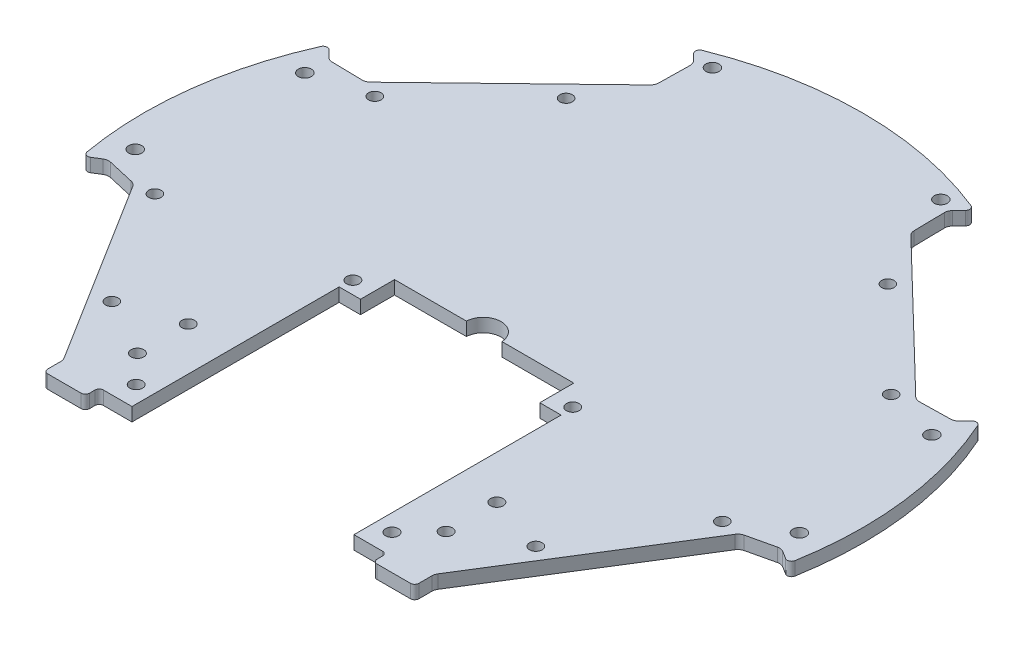
from build123d import *

# Parameters (mm, degrees)
BOSS_EXTRUDE4_DEPTH  = 1.5875
M3_CLEARANCE_HOLE3_D = 3
M3_CLEARANCE_HOLE1_D = 3.1
M3_CLEARANCE_HOLE4_D = 2.95
M3_CLEARANCE_HOLE2_D = 3.1
BOSS_EXTRUDE6_DEPTH  = 3.175
FILLET1_R            = 2
FILLET3_R            = 1
FILLET6_R            = 0.5
CUT_EXTRUDE4_DEPTH   = 10
SKETCH29_R           = 1.5
CUT_EXTRUDE5_DEPTH   = 10
SKETCH31_R           = 1.5
CUT_EXTRUDE7_DEPTH   = 10


with BuildPart() as part:
    # Sketch1 → Boss-Extrude4 (new, symmetric)
    with BuildSketch(Plane(origin=(0, 0, 0), x_dir=(1, 0, 0), z_dir=(0, 1, 0))):
        with BuildLine():
            Line((-62.799553621, 32.496136604), (-73.969425011, 32.691107434))
            Line((-73.969425011, 32.691107434), (-77.053684287, 35.88495141))
            ThreePointArc((-77.053684287, 35.88495141), (-84.36642289, 10.358894189), (-83.446216027, -16.178041625))
            Line((-83.446216027, -16.178041625), (-79.680911643, -13.825218315))
            Line((-79.680911643, -13.825218315), (-69.484649137, -16.179210996))
            Line((-69.484649137, -16.179210996), (-43.894490772, -57.132025032))
            Line((-43.894490772, -57.132025032), (-43.894490772, -64.826600275))
            Line((-43.894490772, -64.826600275), (-43.094490772, -64.826600275))
            Line((-43.094490772, -64.826600275), (-34, -64.826600275))
            Line((-34, -64.826600275), (-34, -62.55))
            Line((-34, -62.55), (-34, -61.55))
            Line((-34, -61.55), (-20, -61.55))
            Line((-20, -61.55), (-19.859459165, -62.55))
            Line((-19.859459165, -62.55), (19.859459165, -62.55))
            Line((19.859459165, -62.55), (20, -61.55))
            Line((20, -61.55), (34, -61.55))
            Line((34, -61.55), (34, -62.55))
            Line((34, -62.55), (34, -64.826600275))
            Line((34, -64.826600275), (43.094490772, -64.826600275))
            Line((43.094490772, -64.826600275), (43.894490772, -64.826600275))
            Line((43.894490772, -64.826600275), (43.894490772, -57.132025032))
            Line((43.894490772, -57.132025032), (69.484649137, -16.179210996))
            Line((69.484649137, -16.179210996), (79.680911643, -13.825218315))
            Line((79.680911643, -13.825218315), (83.446216027, -16.178041625))
            ThreePointArc((83.446216027, -16.178041625), (84.610662337, -8.126242604), (85, 0))
            ThreePointArc((85, 0), (82.98964744, 18.377116688), (77.053684287, 35.88495141))
            Line((77.053684287, 35.88495141), (73.969425011, 32.691107434))
            Line((73.969425011, 32.691107434), (62.799553621, 32.496136604))
            Line((62.799553621, 32.496136604), (30.284668021, 63.895396642))
            Line((30.284668021, 63.895396642), (30.089697191, 75.065268032))
            Line((30.089697191, 75.065268032), (33.173956467, 78.259112008))
            ThreePointArc((33.173956467, 78.259112008), (0, 85), (-33.173956467, 78.259112008))
            Line((-33.173956467, 78.259112008), (-30.089697191, 75.065268032))
            Line((-30.089697191, 75.065268032), (-30.284668021, 63.895396642))
            Line((-30.284668021, 63.895396642), (-62.799553621, 32.496136604))
        make_face()
    extrude(amount=BOSS_EXTRUDE4_DEPTH, both=True)

    # M3 Clearance Hole3 (through all)
    with Locations(Plane(origin=(0, -1.5875, 0), x_dir=(-1, 0, 0), z_dir=(0, -1, 0))):
        with Locations((36.5, -50), (36.5, -38), (-36.5, -50), (-36.5, -38)):
            Hole(M3_CLEARANCE_HOLE3_D / 2)

    # M3 Clearance Hole1 (through all)
    with Locations(Plane(origin=(0, 1.5875, 0), x_dir=(1, 0, 0), z_dir=(0, 1, 0))):
        with Locations((-78.542321426, -8.49139241), (78.542321426, -8.49139241), (74.155025063, 27.240269049), (-74.155025063, 27.240269049)):
            Hole(M3_CLEARANCE_HOLE1_D / 2)

    # M3 Clearance Hole4 (through all)
    with Locations(Plane(origin=(0, -1.5875, 0), x_dir=(-1, 0, 0), z_dir=(0, -1, 0))):
        with Locations((-67.099301622, -15.278865202), (-50.141885166, -42.416404279), (-61.062544382, 30.698137949), (-38.043670771, 52.927205804), (50.141885166, -42.416404279), (67.099301622, -15.278865202), (38.043670771, 52.927205804), (61.062544382, 30.698137949)):
            Hole(M3_CLEARANCE_HOLE4_D / 2)

    # M3 Clearance Hole2 (through all)
    with Locations(Plane(origin=(0, 1.5875, 0), x_dir=(1, 0, 0), z_dir=(0, 1, 0))):
        with Locations((27, 76.497766718), (-27, 76.497766718)):
            Hole(M3_CLEARANCE_HOLE2_D / 2)

    # Sketch22 → Boss-Extrude6 (add)
    with BuildSketch(Plane(origin=(0, 1.5875, 0), x_dir=(1, 0, 0), z_dir=(0, 1, 0))):
        Polygon((65.061950694, 32.535626892), (30.245177733, 66.157793715), (30.284668021, 63.895396642), (62.799553621, 32.496136604), align=None)
        Polygon((-30.284668021, 63.895396642), (-30.245177733, 66.157793715), (-65.061950694, 32.535626892), (-62.799553621, 32.496136604), align=None)
        Polygon((43.894490772, -60.151352895), (71.689396914, -15.670204865), (69.484649137, -16.179210996), (43.894490772, -57.132025032), align=None)
        Polygon((-69.484649137, -16.179210996), (-71.689396914, -15.670204865), (-43.894490772, -60.151352895), (-43.894490772, -57.132025032), align=None)
    extrude(amount=-BOSS_EXTRUDE6_DEPTH)

    # Fillet1
    fillet1_edges = [part.edges().sort_by_distance(p)[0] for p in [
        (-30.245177733, 0.79375, -66.157793715),
        (-65.061950694, 0.79375, -32.535626892),
        (-71.689396914, 0.79375, 15.670204865),
        (-43.894490772, 0.79375, 60.151352895),
        (43.894490772, -0.79375, 60.151352895),
        (71.689396914, -0.79375, 15.670204865),
        (65.061950694, 0.79375, -32.535626892),
        (30.245177733, -0.79375, -66.157793715),
        (30.089697191, -0.79375, -75.065268032),
        (73.969425011, -0.79375, -32.691107434),
        (79.680911643, -0.79375, 13.825218315),
        (-79.680911643, -0.79375, 13.825218315),
        (-73.969425011, -0.79375, -32.691107434),
        (-30.089697191, -0.79375, -75.065268032),
    ]]
    fillet(fillet1_edges, radius=FILLET1_R)

    # Fillet3
    fillet3_edges = [part.edges().sort_by_distance(p)[0] for p in [
        (33.173956467, -0.79375, -78.259112008),
        (77.053684287, 0.79375, -35.88495141),
        (83.446216027, -0.79375, 16.178041625),
        (43.894490772, -0.79375, 64.826600275),
        (34, 0.79375, 64.826600275),
        (34, -0.79375, 61.55),
        (-34, -0.79375, 61.55),
        (-34, 0.79375, 64.826600275),
        (-43.894490772, -0.79375, 64.826600275),
        (-83.446216027, -0.79375, 16.178041625),
        (-77.053684287, -0.79375, -35.88495141),
        (-33.173956467, -0.79375, -78.259112008),
    ]]
    fillet(fillet3_edges, radius=FILLET3_R - 0.0001)  # a hair under: the kernel refuses the full size

    # Fillet6
    fillet6_edges = [part.edges().sort_by_distance(p)[0] for p in [
        (20, -0.79375, 61.55),
        (19.859459165, -0.79375, 62.55),
        (-19.859459165, 0.79375, 62.55),
        (-20, 0.79375, 61.55),
    ]]
    fillet(fillet6_edges, radius=FILLET6_R)

    # Sketch28 → Cut-Extrude4 (cut)
    with BuildSketch(Plane(origin=(0, 1.5875, 0), x_dir=(1, 0, 0), z_dir=(0, 1, 0))):
        with BuildLine():
            Line((-26.25, -12.55), (-26.25, -62.55))
            Line((-26.25, -62.55), (26.25, -62.55))
            Line((26.25, -62.55), (26.25, -12.55))
            Line((26.25, -12.55), (21.2, -12.55))
            Line((21.2, -12.55), (21.2, -4.5))
            Line((21.2, -4.5), (4.195235393, -4.5))
            ThreePointArc((4.195235393, -4.5), (0, -0.5), (-4.195235393, -4.5))
            Line((-4.195235393, -4.5), (-21.2, -4.5))
            Line((-21.2, -4.5), (-21.2, -12.55))
            Line((-21.2, -12.55), (-26.25, -12.55))
        make_face()
    extrude(amount=-CUT_EXTRUDE4_DEPTH, mode=Mode.SUBTRACT)

    # Sketch29 → Cut-Extrude5 (cut)
    with BuildSketch(Plane(origin=(0, 1.5875, 0), x_dir=(1, 0, 0), z_dir=(0, 1, 0))):
        with Locations(Location((30.25, -56.55, 0), (0, 0, 270))):
            Circle(SKETCH29_R)
        with Locations(Location((-30.25, -56.55, 0), (0, 0, 270))):
            Circle(SKETCH29_R)
    extrude(amount=-CUT_EXTRUDE5_DEPTH, mode=Mode.SUBTRACT)

    # Sketch31 → Cut-Extrude7 (cut)
    with BuildSketch(Plane(origin=(0, 1.5875, 0), x_dir=(1, 0, 0), z_dir=(0, 1, 0))):
        with Locations(Location((-26, -9.55, 0), (0, 0, 270))):
            Circle(SKETCH31_R)
        with Locations(Location((26, -9.55, 0), (0, 0, 270))):
            Circle(SKETCH31_R)
    extrude(amount=-CUT_EXTRUDE7_DEPTH, mode=Mode.SUBTRACT)


solid = part.part
